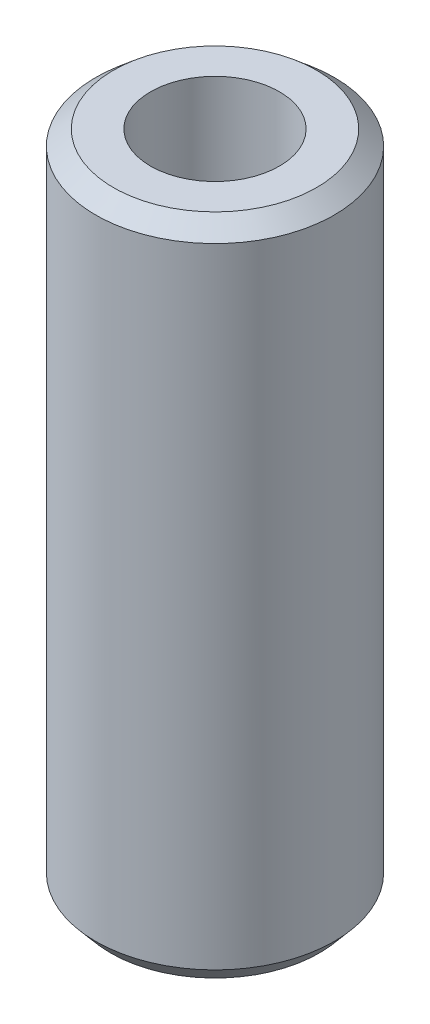
from build123d import *
from OCP.BRepFilletAPI import BRepFilletAPI_MakeChamfer

# Parameters (mm, degrees)
SKETCH1_R           = 10
BOSS_EXTRUDE1_DEPTH = 55.47617558
SKETCH2_R           = 5.404774497
CUT_EXTRUDE1_DEPTH  = 58.250380409
CHAMFER1_SIZE       = 1.255926124
CHAMFER1_SIZE2      = 1.477093824


with BuildPart() as part:
    # Sketch1 → Boss-Extrude1 (new body)
    with BuildSketch(Plane(origin=(0, 0, 0), x_dir=(1, 0, 0), z_dir=(0, 1, 0))):
        Circle(SKETCH1_R)
    extrude(amount=BOSS_EXTRUDE1_DEPTH)

    # Sketch2 → Cut-Extrude1 (cut, through all)
    with BuildSketch(Plane(origin=(0, 0, 0), x_dir=(1, 0, 0), z_dir=(0, 1, 0))):
        Circle(SKETCH2_R)
    extrude(amount=CUT_EXTRUDE1_DEPTH, mode=Mode.SUBTRACT)

    # Chamfer1: one chamfer whose edges measure the first distance from different faces: ONE call of the kernel's chamfer builder (chamfer() names one face for all edges)
    chamfer1_edges_1 = [part.edges().sort_by_distance(p)[0] for p in [
        (-10, 55.47617558, 0),
    ]]
    chamfer1_side_1 = [part.faces().sort_by_distance(p)[0] for p in [
        (-10, 27.73808779, 0),
    ]]
    chamfer1_edges_2 = [part.edges().sort_by_distance(p)[0] for p in [
        (-10, 0, 0),
    ]]
    chamfer1_side_2 = [part.faces().sort_by_distance(p)[0] for p in [
        (-9.717157288, 0, 0),
    ]]
    chamfer1 = BRepFilletAPI_MakeChamfer(part.part.solid().wrapped)
    for e in chamfer1_edges_1:
        chamfer1.Add(CHAMFER1_SIZE, CHAMFER1_SIZE2, e.wrapped, chamfer1_side_1[0].wrapped)  # the first distance lies on this face
    for e in chamfer1_edges_2:
        chamfer1.Add(CHAMFER1_SIZE, CHAMFER1_SIZE2, e.wrapped, chamfer1_side_2[0].wrapped)  # the first distance lies on this face
    add(Compound.cast(chamfer1.Shape()), mode=Mode.REPLACE)


solid = part.part
